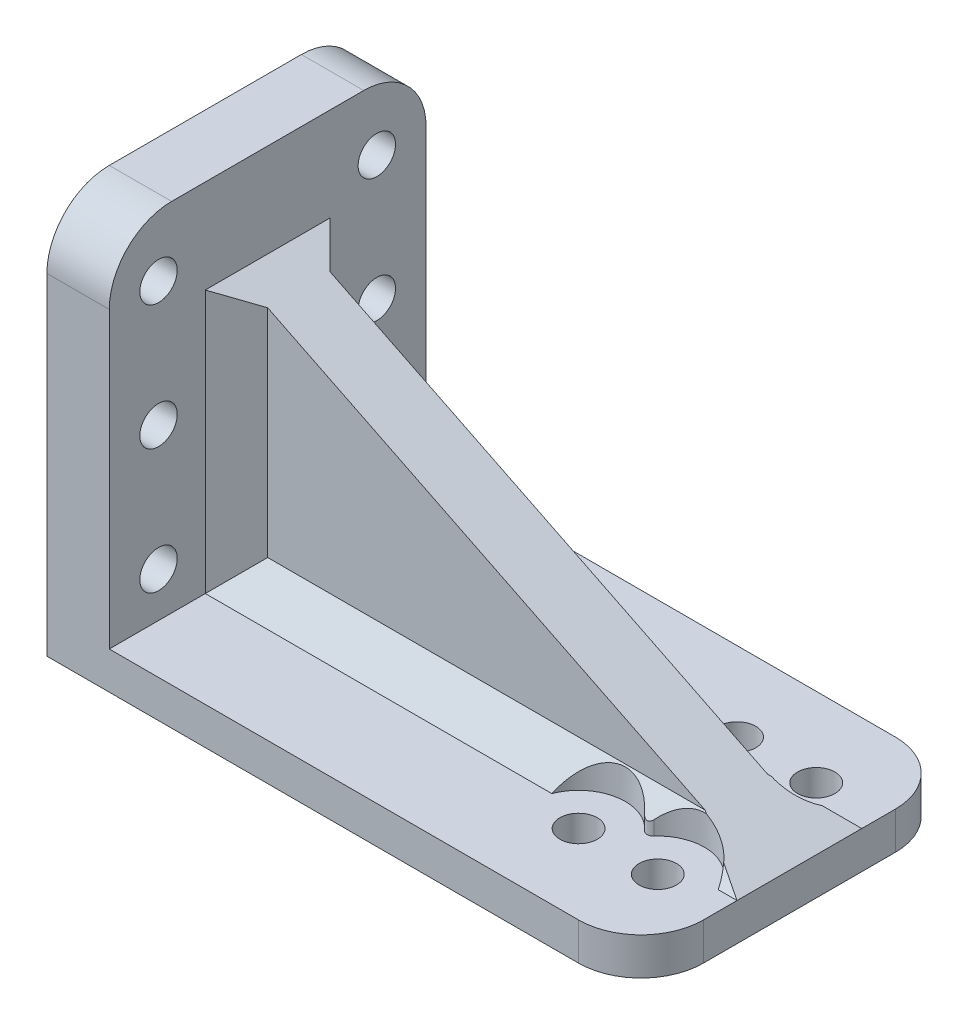
from build123d import *

# Parameters (mm, degrees)
SKETCH1_W               = 10
SKETCH1_H               = 57.15
SKETCH1_W_2             = 95.25
SKETCH1_H_2             = 6
BOSS_EXTRUDE1_DEPTH     = 25.4
RIB1_REACH              = 82.817
SKETCH2_WALL_W          = 258.734123662
SKETCH2_WALL_H          = 10
CHAMFER2_SIZE           = 5
CHAMFER3_SIZE           = 5
CUT_EXTRUDE1_DEPTH      = 79.60930686
CUT_EXTRUDE1_DEPTH_BACK = 79.60930686
SKETCH3_R               = 3
SKETCH4_R               = 7.5
CUT_EXTRUDE2_DEPTH      = 79.60930686
FILLET1_R               = 10
FILLET2_R               = 10
CUT_EXTRUDE3_REACH      = 109.381
SKETCH5_R               = 3
FILLET3_R               = 1


with BuildPart() as part:
    # Sketch1 → Boss-Extrude1 (new, symmetric)
    with BuildSketch(Plane.XY):
        with Locations((-42.625, 31.575)):
            Rectangle(SKETCH1_W, SKETCH1_H)
        Rectangle(SKETCH1_W_2, SKETCH1_H_2)
    extrude(amount=BOSS_EXTRUDE1_DEPTH, both=True)

    # Sketch2 wall → Rib1 (add, up to next)
    with BuildSketch(Plane(origin=(5, 24.075, 0), x_dir=(0.896416143278, -0.443213377586, 0), z_dir=(0.443213377586, 0.896416143278, 0)), mode=Mode.PRIVATE) as rib1_sk1:
        Rectangle(SKETCH2_WALL_W, SKETCH2_WALL_H)
    rib1_tool1 = extrude(rib1_sk1.sketch, amount=-RIB1_REACH, mode=Mode.PRIVATE) - part.part
    add(rib1_tool1.solids().sort_by_distance((5, 24.075, 0))[0])

    # Chamfer2
    chamfer2_edges = [part.edges().sort_by_distance(p)[0] for p in [
        (-37.625, 24.075, 5),
        (5, 3, 5),
    ]]
    chamfer(chamfer2_edges, length=CHAMFER2_SIZE)

    # Chamfer3
    # the kernel refuses this chamfer: 5 mm, written as the material it adds along each edge
    with BuildSketch(Plane(origin=(-37.625, 58.00841494, -5), x_dir=(-0.027495876610586317, 0, -0.9996219169112968), z_dir=(0, -1, 0))) as chamfer3_piece_1_section:
        Polygon((CHAMFER3_SIZE * 0.999621916911, CHAMFER3_SIZE * 0.0274958766106), (-CHAMFER3_SIZE * 0.0274958766106, CHAMFER3_SIZE * 0.999621916911), (0, 0), align=None)
    chamfer3_piece_1 = extrude(amount=55.00841494, mode=Mode.PRIVATE)
    chamfer3_piece_1 = split(chamfer3_piece_1, bisect_by=Plane(origin=(-27.763842546, 40.274366139, -6.674975075), z_dir=(-0.4432133775858684, -0.8964161432777338, 0)), keep=Keep.TOP, mode=Mode.PRIVATE)
    add(chamfer3_piece_1)
    with BuildSketch(Plane(origin=(60.48341494, 3, -5), x_dir=(0, 0.9996219169112968, 0.027495876610586244), z_dir=(-1, 0, 0))) as chamfer3_piece_2_section:
        Polygon((CHAMFER3_SIZE * 0.999621916911, CHAMFER3_SIZE * 0.0274958766106), (-CHAMFER3_SIZE * 0.0274958766106, CHAMFER3_SIZE * 0.999621916911), (0, 0), align=None)
    chamfer3_piece_2 = extrude(amount=110.96682988, mode=Mode.PRIVATE)
    chamfer3_piece_2 = split(chamfer3_piece_2, bisect_by=Plane(origin=(-47.625, 4.632358995, -6.683820502), z_dir=(1, 0, 0)), keep=Keep.TOP, mode=Mode.PRIVATE)
    chamfer3_piece_2 = split(chamfer3_piece_2, bisect_by=Plane(origin=(11.398148356, 20.911575329, -6.683820502), z_dir=(-0.4432133775858684, -0.8964161432777338, 0)), keep=Keep.TOP, mode=Mode.PRIVATE)
    add(chamfer3_piece_2)

    # Sketch3 → Cut-Extrude1 (cut, two sides: drawn at the far end of the back side and taken through both)
    with BuildSketch(Plane(origin=(0, 3, 0), x_dir=(1, 0, 0), z_dir=(0, 1, 0)).offset(-CUT_EXTRUDE1_DEPTH_BACK)):
        with Locations(Location((24.925, 12.7, 0), (0, 0, 270))):
            Circle(SKETCH3_R)
        with Locations(Location((24.925, -12.7, 0), (0, 0, 270))):
            Circle(SKETCH3_R)
        with Locations(Location((37.625, -12.7, 0), (0, 0, 270))):
            Circle(SKETCH3_R)
        with Locations(Location((37.625, 12.7, 0), (0, 0, 270))):
            Circle(SKETCH3_R)
    extrude(amount=CUT_EXTRUDE1_DEPTH + CUT_EXTRUDE1_DEPTH_BACK, mode=Mode.SUBTRACT)

    # Sketch4 → Cut-Extrude2 (cut, through all)
    with BuildSketch(Plane(origin=(0, 3, 0), x_dir=(1, 0, 0), z_dir=(0, 1, 0))):
        with BuildLine():
            ThreePointArc((31.275, -16.690927211), (39.701655966, -19.906767653), (45.125, -12.7))
            ThreePointArc((45.125, -12.7), (44.998213921, -11.326786079), (44.622142274, -10))
            Line((44.622142274, -10), (38.932669683, -10))
            ThreePointArc((38.932669683, -10), (37.625, -15.7), (36.317330317, -10))
            Line((36.317330317, -10), (31.922142274, -10))
            ThreePointArc((31.922142274, -10), (32.298213921, -11.326786079), (32.425, -12.7))
            ThreePointArc((32.425, -12.7), (32.131767653, -14.776655966), (31.275, -16.690927211))
        make_face()
        with BuildLine():
            Line((38.932669683, -10), (44.622142274, -10))
            ThreePointArc((44.622142274, -10), (38.347026001, -5.234835671), (31.275, -8.709072789))
            ThreePointArc((31.275, -8.709072789), (31.629712894, -9.338925021), (31.922142274, -10))
            Line((31.922142274, -10), (36.317330317, -10))
            ThreePointArc((36.317330317, -10), (37.625, -15.7), (38.932669683, -10))
        make_face()
        with BuildLine():
            ThreePointArc((17.927857726, -10), (21.563925021, -19.404712894), (31.275, -16.690927211))
            ThreePointArc((31.275, -16.690927211), (30.159835671, -13.422026001), (30.627857726, -10))
            Line((30.627857726, -10), (26.232669683, -10))
            ThreePointArc((26.232669683, -10), (24.925, -15.7), (23.617330317, -10))
            Line((23.617330317, -10), (17.927857726, -10))
        make_face()
        with BuildLine():
            ThreePointArc((30.627857726, -10), (30.920287106, -9.338925021), (31.275, -8.709072789))
            ThreePointArc((31.275, -8.709072789), (24.202973999, -5.234835671), (17.927857726, -10))
            Line((17.927857726, -10), (23.617330317, -10))
            ThreePointArc((23.617330317, -10), (24.925, -15.7), (26.232669683, -10))
            Line((26.232669683, -10), (30.627857726, -10))
        make_face()
        with BuildLine():
            ThreePointArc((30.627857726, -10), (30.159835671, -13.422026001), (31.275, -16.690927211))
            ThreePointArc((31.275, -16.690927211), (32.131767653, -14.776655966), (32.425, -12.7))
            ThreePointArc((32.425, -12.7), (32.298213921, -11.326786079), (31.922142274, -10))
            Line((31.922142274, -10), (30.627857726, -10))
        make_face()
        with BuildLine():
            ThreePointArc((31.922142274, -10), (31.629712894, -9.338925021), (31.275, -8.709072789))
            ThreePointArc((31.275, -8.709072789), (30.920287106, -9.338925021), (30.627857726, -10))
            Line((30.627857726, -10), (31.922142274, -10))
        make_face()
        with Locations((24.925, 12.7)):
            Circle(SKETCH4_R)
        with Locations((37.625, 12.7)):
            Circle(SKETCH4_R)
    extrude(amount=CUT_EXTRUDE2_DEPTH, mode=Mode.SUBTRACT)

    # Fillet1
    fillet1_edges = [part.edges().sort_by_distance(p)[0] for p in [
        (47.625, 0, 25.4),
        (47.625, 0, -25.4),
    ]]
    fillet(fillet1_edges, radius=FILLET1_R)

    # Fillet2
    fillet2_edges = [part.edges().sort_by_distance(p)[0] for p in [
        (-42.625, 60.15, 25.4),
        (-42.625, 60.15, -25.4),
    ]]
    fillet(fillet2_edges, radius=FILLET2_R)

    # Sketch5 → Cut-Extrude3 (cut, up to next)
    with BuildSketch(Plane(origin=(-37.625, 0, 0), x_dir=(0, 0, -1), z_dir=(1, 0, 0)), mode=Mode.PRIVATE) as cut_extrude3_sk1:
        with Locations(Location((-17.5, 50.15, 0), (0, 0, 90))):
            Circle(SKETCH5_R)
    cut_extrude3_tool1 = extrude(cut_extrude3_sk1.sketch, amount=-CUT_EXTRUDE3_REACH, mode=Mode.PRIVATE) & part.part
    # Sketch5 → Cut-Extrude3 (cut, up to next)
    with BuildSketch(Plane(origin=(-37.625, 0, 0), x_dir=(0, 0, -1), z_dir=(1, 0, 0)), mode=Mode.PRIVATE) as cut_extrude3_sk2:
        with Locations(Location((17.5, 50.15, 0), (0, 0, 90))):
            Circle(SKETCH5_R)
    cut_extrude3_tool2 = extrude(cut_extrude3_sk2.sketch, amount=-CUT_EXTRUDE3_REACH, mode=Mode.PRIVATE) & part.part
    # Sketch5 → Cut-Extrude3 (cut, up to next)
    with BuildSketch(Plane(origin=(-37.625, 0, 0), x_dir=(0, 0, -1), z_dir=(1, 0, 0)), mode=Mode.PRIVATE) as cut_extrude3_sk3:
        with Locations(Location((17.5, 30.15, 0), (0, 0, 90))):
            Circle(SKETCH5_R)
    cut_extrude3_tool3 = extrude(cut_extrude3_sk3.sketch, amount=-CUT_EXTRUDE3_REACH, mode=Mode.PRIVATE) & part.part
    # Sketch5 → Cut-Extrude3 (cut, up to next)
    with BuildSketch(Plane(origin=(-37.625, 0, 0), x_dir=(0, 0, -1), z_dir=(1, 0, 0)), mode=Mode.PRIVATE) as cut_extrude3_sk4:
        with Locations(Location((-17.5, 30.15, 0), (0, 0, 90))):
            Circle(SKETCH5_R)
    cut_extrude3_tool4 = extrude(cut_extrude3_sk4.sketch, amount=-CUT_EXTRUDE3_REACH, mode=Mode.PRIVATE) & part.part
    # Sketch5 → Cut-Extrude3 (cut, up to next)
    with BuildSketch(Plane(origin=(-37.625, 0, 0), x_dir=(0, 0, -1), z_dir=(1, 0, 0)), mode=Mode.PRIVATE) as cut_extrude3_sk5:
        with Locations(Location((-17.5, 10.15, 0), (0, 0, 90))):
            Circle(SKETCH5_R)
    cut_extrude3_tool5 = extrude(cut_extrude3_sk5.sketch, amount=-CUT_EXTRUDE3_REACH, mode=Mode.PRIVATE) & part.part
    # Sketch5 → Cut-Extrude3 (cut, up to next)
    with BuildSketch(Plane(origin=(-37.625, 0, 0), x_dir=(0, 0, -1), z_dir=(1, 0, 0)), mode=Mode.PRIVATE) as cut_extrude3_sk6:
        with Locations(Location((17.5, 10.15, 0), (0, 0, 90))):
            Circle(SKETCH5_R)
    cut_extrude3_tool6 = extrude(cut_extrude3_sk6.sketch, amount=-CUT_EXTRUDE3_REACH, mode=Mode.PRIVATE) & part.part
    add(cut_extrude3_tool1.solids().sort_by_distance((-37.625, 50.15, 17.5))[0], mode=Mode.SUBTRACT)
    add(cut_extrude3_tool2.solids().sort_by_distance((-37.625, 50.15, -17.5))[0], mode=Mode.SUBTRACT)
    add(cut_extrude3_tool3.solids().sort_by_distance((-37.625, 30.15, -17.5))[0], mode=Mode.SUBTRACT)
    add(cut_extrude3_tool4.solids().sort_by_distance((-37.625, 30.15, 17.5))[0], mode=Mode.SUBTRACT)
    add(cut_extrude3_tool5.solids().sort_by_distance((-37.625, 10.15, 17.5))[0], mode=Mode.SUBTRACT)
    add(cut_extrude3_tool6.solids().sort_by_distance((-37.625, 10.15, -17.5))[0], mode=Mode.SUBTRACT)

    # Fillet3
    # the kernel refuses this fillet: 1 mm, written as the material it takes off along each edge
    with BuildSketch(Plane(origin=(31.275, 7.401030704, -8.709072789), x_dir=(-0.6005096173498707, 0, 0.7996175332434325), z_dir=(0, -1, 0))) as fillet3_piece_1:
        with BuildLine():
            CenterArc((1.326977491, -0.996554868), FILLET3_R, 94.7573526, 96.67248475)
            ThreePointArc((0.346809381, -1.194722667), (0.198218842, -0.590158172), (0, 0))
            ThreePointArc((0, 0), (0.622020699, -0.025838492), (1.244041397, 0))
        make_face()
    extrude(amount=4.401030704, mode=Mode.SUBTRACT)
    with BuildSketch(Plane(origin=(31.275, 3, 8.709072789), x_dir=(0.6005096173499003, 0, -0.7996175332434102), z_dir=(0, 1, 0))) as fillet3_piece_2:
        with BuildLine():
            CenterArc((1.326977491, 0.996554868), FILLET3_R, 168.570162651, 96.67248475)
            ThreePointArc((0.346809381, 1.194722667), (0.198218842, 0.590158172), (0, 0))
            ThreePointArc((0, 0), (0.622020699, 0.025838492), (1.244041397, 0))
        make_face()
    extrude(amount=4.401030704, mode=Mode.SUBTRACT)


solid = part.part
